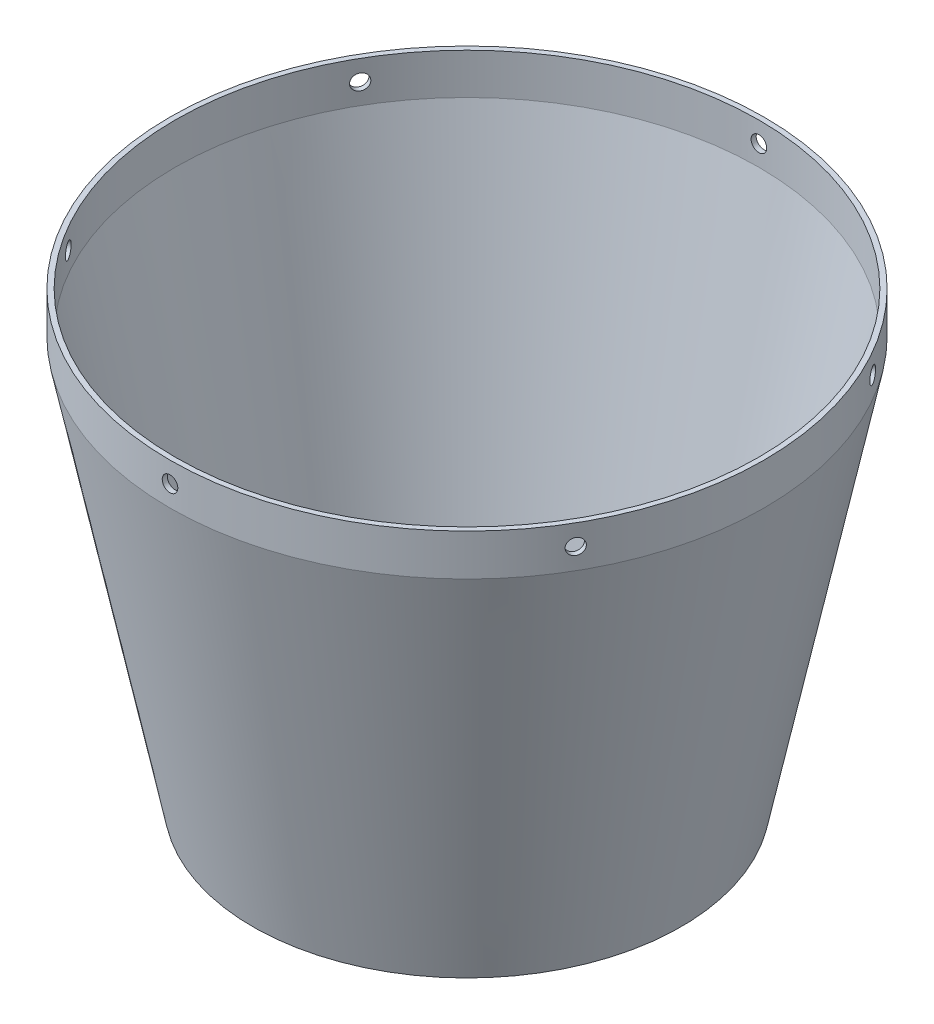
from build123d import *

# Parameters (mm, degrees)
SKETCH2_R          = 2.413
CUT_EXTRUDE1_DEPTH = 181.786908835
CIRPATTERN1_COUNT  = 6


with BuildPart() as part:
    # Sketch1 → Revolve1 (revolve)
    with BuildSketch(Plane.XY):
        Polygon((90.4875, 0), (90.4875, 12.7), (92.075, 12.7), (92.075, -0.161142854), (66.382413919, -125.4125), (65.0875, -125.4125), (65.0875, -123.825), align=None)
    revolve(axis=Axis((0, 0, 0), (0, -1, 0)))

    # Sketch2 → Cut-Extrude1 (cut, symmetric)
    with BuildSketch(Plane.XY):
        with Locations((0, 6.35)):
            Circle(SKETCH2_R)
    cut_extrude1 = extrude(amount=CUT_EXTRUDE1_DEPTH, both=True, mode=Mode.SUBTRACT)

    # CirPattern1: Cut-Extrude1 ×6 about axis
    cirpattern1_axis = Axis((0, 12.7, 0), (0, 1, 0))
    for i in range(1, CIRPATTERN1_COUNT):
        add(cut_extrude1.rotate(cirpattern1_axis, i * 360 / CIRPATTERN1_COUNT), mode=Mode.SUBTRACT)


solid = part.part
